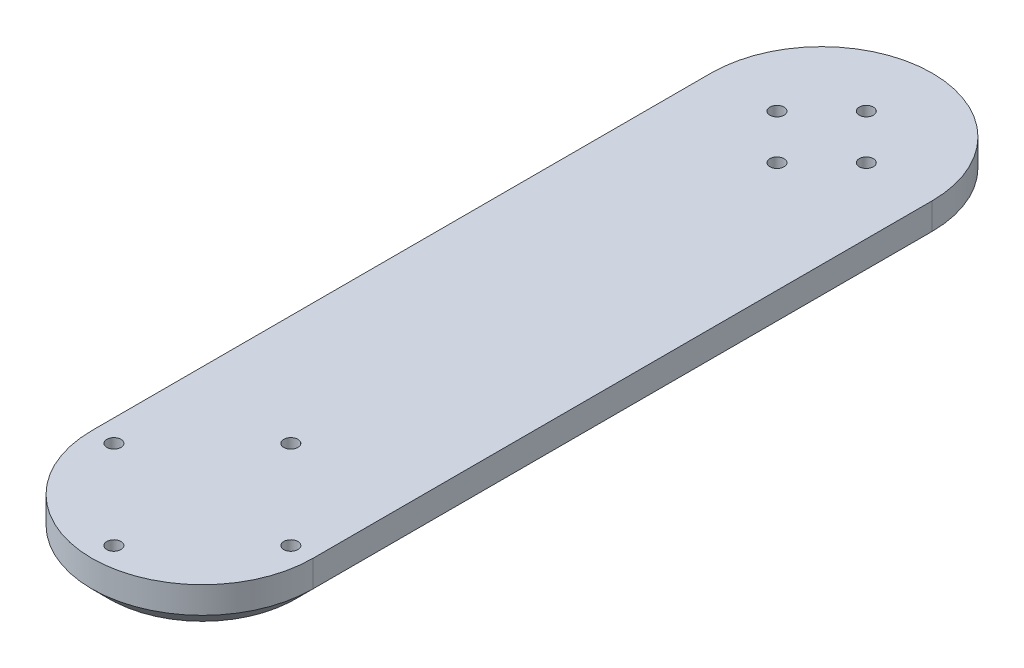
from build123d import *

# Parameters (mm, degrees)
BOSS_EXTRUDE1_DEPTH = 10
SKETCH3_R           = 1.6
CUT_EXTRUDE1_DEPTH  = 168.182534973
SKETCH4_R           = 1.6
CUT_EXTRUDE2_DEPTH  = 168.182534973
CHAMFER1_SIZE       = 4


with BuildPart() as part:
    # Sketch1 → Boss-Extrude1 (new body)
    with BuildSketch(Plane(origin=(0, 0, 0), x_dir=(1, 0, 0), z_dir=(0, 1, 0))):
        with BuildLine():
            Line((-25, 0), (-25, -140))
            ThreePointArc((-25, -140), (0, -165), (25, -140))
            Line((25, -140), (25, 0))
            ThreePointArc((25, 0), (0, 25), (-25, 0))
        make_face()
    extrude(amount=BOSS_EXTRUDE1_DEPTH)

    # Sketch3 → Cut-Extrude1 (cut, through all)
    with BuildSketch(Plane.XZ):
        with Locations(Location((10.098593171, 0, 0), (0, 0, 270))):
            Circle(SKETCH3_R)
        with Locations(Location((0, 10.098593171, 0), (0, 0, 270))):
            Circle(SKETCH3_R)
        with Locations(Location((0, -10.098593171, 0), (0, 0, 270))):
            Circle(SKETCH3_R)
        with Locations(Location((-10.098593171, 0, 0), (0, 0, 270))):
            Circle(SKETCH3_R)
    extrude(amount=-CUT_EXTRUDE1_DEPTH, mode=Mode.SUBTRACT)

    # Sketch4 → Cut-Extrude2 (cut, through all)
    with BuildSketch(Plane.XZ):
        with Locations(Location((0, 120, 0), (0, 0, 270))):
            Circle(SKETCH4_R)
        with Locations(Location((20, 140, 0), (0, 0, 270))):
            Circle(SKETCH4_R)
        with Locations(Location((0, 160, 0), (0, 0, 270))):
            Circle(SKETCH4_R)
        with Locations(Location((-20, 140, 0), (0, 0, 270))):
            Circle(SKETCH4_R)
    extrude(amount=-CUT_EXTRUDE2_DEPTH, mode=Mode.SUBTRACT)

    # Chamfer1
    # the kernel refuses this chamfer: 4 mm, written as the material it takes off along each edge
    with BuildSketch(Plane(origin=(25, 0, 140), x_dir=(-0.9996219169112968, -0.027495876610586365, 0), z_dir=(0, 0, -1))) as chamfer1_piece_1:
        Polygon((CHAMFER1_SIZE * 0.999621916911, CHAMFER1_SIZE * 0.0274958766106), (-CHAMFER1_SIZE * 0.0274958766106, CHAMFER1_SIZE * 0.999621916911), (0, 0), align=None)
    extrude(amount=140, mode=Mode.SUBTRACT)
    with BuildSketch(Plane(origin=(0, 0, 140), x_dir=(-1, 0, 0), z_dir=(0, 0, -1))) as chamfer1_piece_2:
        Polygon((25, CHAMFER1_SIZE), (25 - CHAMFER1_SIZE, 0), (25, 0), align=None)
    revolve(axis=Axis((0, 0, 140), (0, 1, 0)), revolution_arc=180, mode=Mode.SUBTRACT)
    with BuildSketch(Plane(origin=(-25, 0, 0), x_dir=(-0.027495876610586494, 0.9996219169112968, 0), z_dir=(0, 0, 1))) as chamfer1_piece_3:
        Polygon((CHAMFER1_SIZE * 0.999621916911, -CHAMFER1_SIZE * 0.0274958766106), (-CHAMFER1_SIZE * 0.0274958766106, -CHAMFER1_SIZE * 0.999621916911), (0, 0), align=None)
    extrude(amount=140, mode=Mode.SUBTRACT)
    with BuildSketch(Plane(origin=(0, 0, 0), x_dir=(1, 0, 0), z_dir=(0, 0, 1))) as chamfer1_piece_4:
        Polygon((25, CHAMFER1_SIZE), (25 - CHAMFER1_SIZE, 0), (25, 0), align=None)
    revolve(axis=Axis((0, 0, 0), (0, 1, 0)), revolution_arc=180, mode=Mode.SUBTRACT)


solid = part.part
